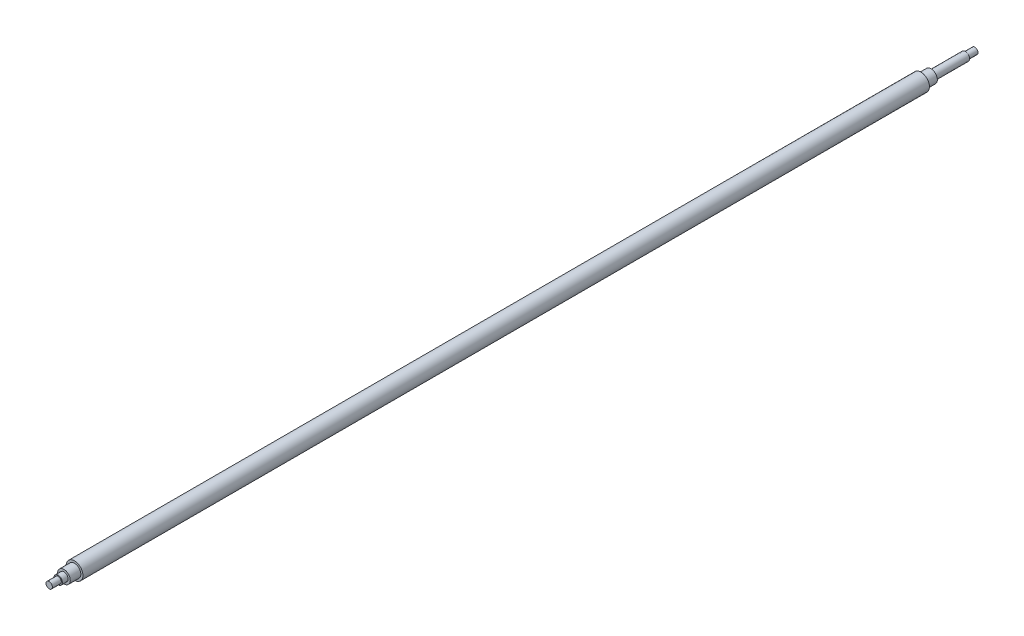
from build123d import *


with BuildPart() as part:
    # Schizzo2 → Rivoluzione2 (revolve)
    with BuildSketch(Plane(origin=(0, 0, 0), x_dir=(0, 0, -1), z_dir=(1, 0, 0))):
        Polygon((0, 0), (0, 3), (8.5, 3), (8.5, 4), (14, 4), (14, 6), (24, 6), (24, 8), (826, 8), (826, 6), (835.5, 6), (835.5, 4), (868, 4), (868, 3), (877, 3), (877, 0), align=None)
    revolve(axis=Axis((0, 0, 0), (0, 0, -1)))


solid = part.part
